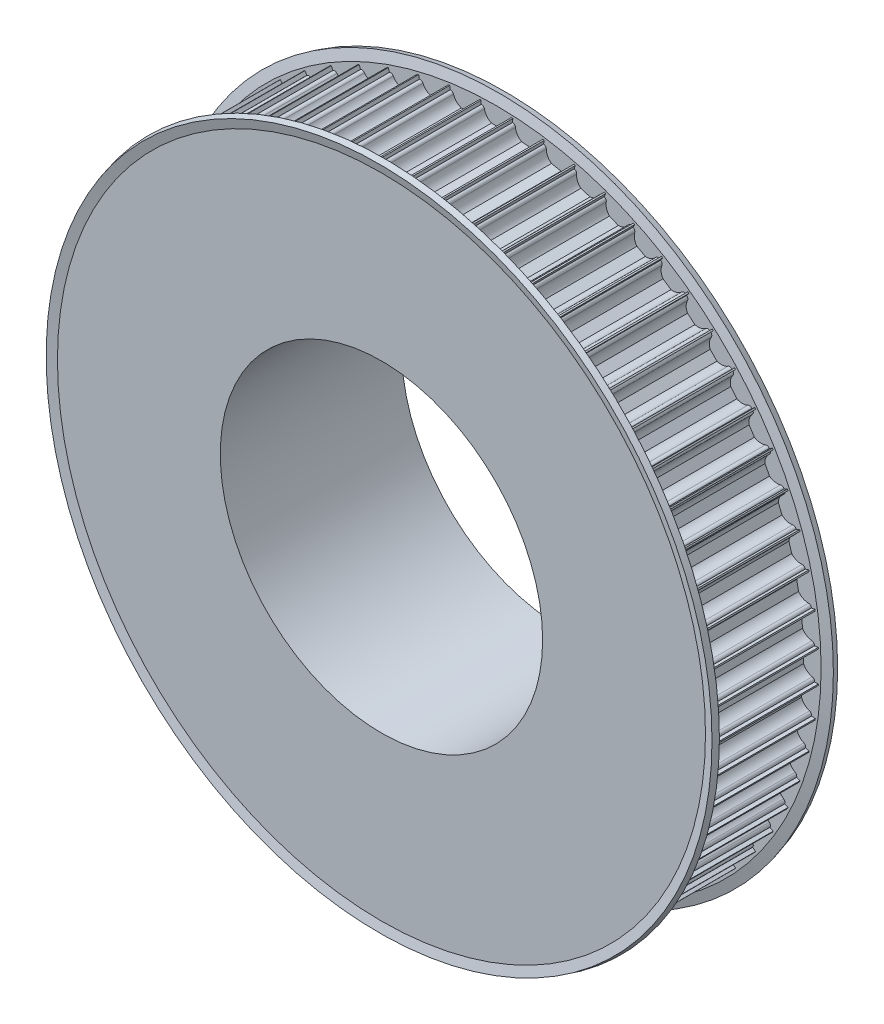
from build123d import *

# Parameters (mm, degrees)
CUT_EXTRUDE1_REACH = 123.758
CIRPATTERN1_COUNT  = 64


with BuildPart() as part:
    # Sketch1 → Revolve1 (revolve)
    with BuildSketch(Plane(origin=(0, 0, 0), x_dir=(0, 0, -1), z_dir=(1, 0, 0))):
        Polygon((0, 40), (45, 40), (45, 55.5), (30, 55.5), (30, 80), (0, 80), align=None)
    revolve(axis=Axis((0, 0, 0), (0, 0, -1)))

    # Sketch2 → Cut-Extrude1 (cut, up to next)
    with BuildSketch(Plane.XY, mode=Mode.PRIVATE) as cut_extrude1_sk1:
        with BuildLine():
            Line((-3.674234614, 79), (-3.75, 79))
            Line((-3.75, 79), (-3.75, 81))
            Line((-3.75, 81), (3.75, 81))
            Line((3.75, 81), (3.75, 79))
            Line((3.75, 79), (3.674234614, 79))
            ThreePointArc((3.674234614, 79), (3.199892965, 78.830947502), (2.939387691, 78.4))
            ThreePointArc((2.939387691, 78.4), (2.331759211, 77.112435701), (1.198957881, 76.25))
            Line((1.198957881, 76.25), (-1.198957881, 76.25))
            ThreePointArc((-1.198957881, 76.25), (-2.331759211, 77.112435701), (-2.939387691, 78.4))
            ThreePointArc((-2.939387691, 78.4), (-3.199892965, 78.830947502), (-3.674234614, 79))
        make_face()
    cut_extrude1_tool1 = extrude(cut_extrude1_sk1.sketch, amount=-CUT_EXTRUDE1_REACH, mode=Mode.PRIVATE) & part.part
    cut_extrude1 = cut_extrude1_tool1.solids().sort_by_distance((0, 78.935169, 0))[0]
    add(cut_extrude1, mode=Mode.SUBTRACT)

    # CirPattern1: Cut-Extrude1 ×64 about axis
    cirpattern1_axis = Axis((0, 0, 0), (0, 0, 1))
    for i in range(1, CIRPATTERN1_COUNT):
        add(cut_extrude1.rotate(cirpattern1_axis, i * 360 / CIRPATTERN1_COUNT), mode=Mode.SUBTRACT)

    # Sketch3 → Revolve2 (revolve)
    with BuildSketch(Plane(origin=(0, 0, 0), x_dir=(0, 0, -1), z_dir=(1, 0, 0))):
        Polygon((30, 55.5), (30, 80.412521254), (30.591966801, 82.621771432), (29.143078062, 83.01), (28.5, 80.61), (28.5, 55.5), align=None)
        Polygon((1.5, 55.5), (0, 55.5), (0, 80.412521254), (-0.591966801, 82.621771432), (0.856921938, 83.01), (1.5, 80.61), align=None)
    revolve(axis=Axis((0, 0, 0), (0, 0, -1)))


solid = part.part
